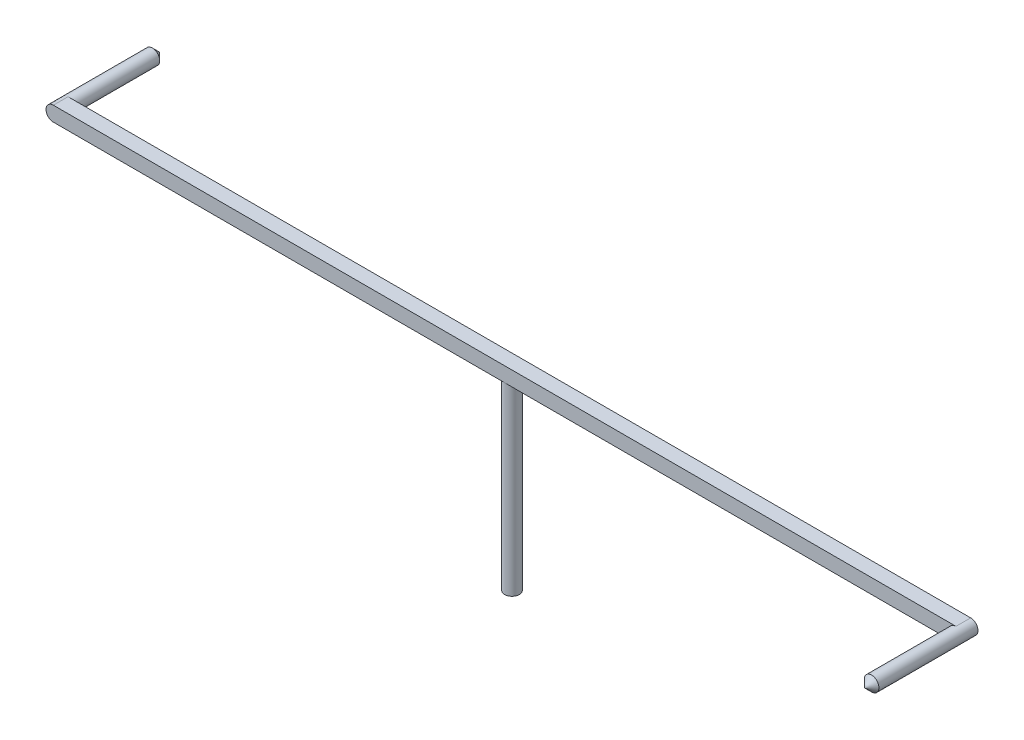
from build123d import *

# Parameters (mm, degrees)
SKETCH_1_R      = 0.4
EXTRUDE_1_DEPTH = 10
SKETCH_2_W      = 50
SKETCH_2_H      = 0.8
EXTRUDE_2_DEPTH = 0.8
FILLET_1_R      = 0.4
SKETCH_3_R      = 0.4
EXTRUDE_3_DEPTH = 5
SKETCH_4_R      = 0.4
EXTRUDE_4_DEPTH = 5
CHAMFER_1_SIZE  = 0.4


with BuildPart() as part:
    # 草图1 → 凸台-拉伸1 (new body)
    with BuildSketch(Plane(origin=(0, 0, 0), x_dir=(1, 0, 0), z_dir=(0, 1, 0))):
        with Locations(Location((0, 0, 0), (0, 0, 270))):
            Circle(SKETCH_1_R)
    extrude(amount=EXTRUDE_1_DEPTH)

    # 草图2 → 凸台-拉伸2 (add)
    with BuildSketch(Plane(origin=(0, 10, 0), x_dir=(1, 0, 0), z_dir=(0, 1, 0))):
        Rectangle(SKETCH_2_W, SKETCH_2_H)
    extrude(amount=EXTRUDE_2_DEPTH)

    # 圆角1
    fillet_1_edges = [part.edges().sort_by_distance(p)[0] for p in [
        (25, 10, 0),
        (25, 10.8, 0),
        (-25, 10, 0),
        (-25, 10.8, 0),
    ]]
    fillet(fillet_1_edges, radius=FILLET_1_R - 0.0001)  # a hair under: the kernel refuses the full size

    # 草图3 → 凸台-拉伸3 (add)
    with BuildSketch(Plane.XY.offset(0.4)):
        with Locations((24.6, 10.4)):
            Circle(SKETCH_3_R)
    extrude(amount=EXTRUDE_3_DEPTH)

    # 草图4 → 凸台-拉伸4 (add)
    with BuildSketch(Plane(origin=(0, 0, -0.4), x_dir=(-1, 0, 0), z_dir=(0, 0, -1))):
        with Locations((24.6, 10.4)):
            Circle(SKETCH_4_R)
    extrude(amount=EXTRUDE_4_DEPTH)

    # 倒角1
    chamfer_1_edges = [part.edges().sort_by_distance(p)[0] for p in [
        (24.2, 10.4, 5.4),
        (-24.2, 10.4, -5.4),
    ]]
    chamfer(chamfer_1_edges, length=CHAMFER_1_SIZE)


solid = part.part
